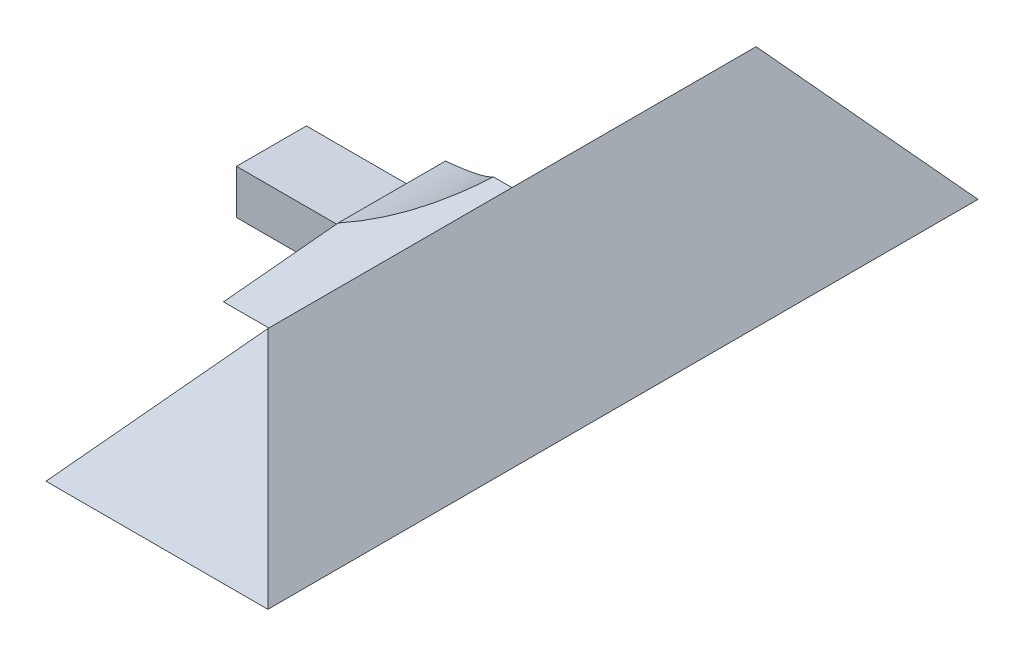
from build123d import *

# Parameters (mm, degrees)
BOSS_EXTRUDE1_START       = -105
BOSS_EXTRUDE1_DEPTH       = 160
BOSS_EXTRUDE1_2_DEPTH     = 40
BOSS_EXTRUDE1_START_2     = -20
BOSS_EXTRUDE1_3_OUTLINE_W = 47
BOSS_EXTRUDE1_3_OUTLINE_H = 147
BOSS_EXTRUDE1_3_DEPTH     = 20
BOSS_EXTRUDE1_START_3     = 42.132444372
BOSS_EXTRUDE1_4_OUTLINE_W = 53
BOSS_EXTRUDE1_4_OUTLINE_H = 116
BOSS_EXTRUDE1_4_DEPTH     = 19.867555628
BOSS_EXTRUDE1_START_4     = 80.434666527
BOSS_EXTRUDE1_5_OUTLINE_W = 52
BOSS_EXTRUDE1_5_OUTLINE_H = 117
BOSS_EXTRUDE1_5_DEPTH     = 20.565333473
SKETCH3_W                 = 27.900715286
SKETCH3_H                 = 15.750403791
BOSS_EXTRUDE2_DEPTH       = 10
SKETCH4_R                 = 75
CUT_EXTRUDE1_DEPTH        = 80


with BuildPart() as part:
    # Boss-Extrude1: read off the stored shape, not the designer's step
    # Boss-Extrude1 outline → Boss-Extrude1 (new body)
    with BuildSketch(Plane.XY.offset(BOSS_EXTRUDE1_START)):
        Polygon((65, 0), (40, 29.793839815), (15, 0), align=None)
    extrude(amount=BOSS_EXTRUDE1_DEPTH)

    # Boss-Extrude1 2 outline → Boss-Extrude1 2 (add)
    with BuildSketch(Plane.YZ):
        Polygon((0, -50), (29.793839815, -25), (0, 0), align=None)
    extrude(amount=BOSS_EXTRUDE1_2_DEPTH)

    # Boss-Extrude1 3 outline → Boss-Extrude1 3 (cut)
    with BuildSketch(Plane(origin=(0, 0, 0), x_dir=(0.6427876096865404, 0.7660444431189772, 0), z_dir=(0.7660444431189772, -0.6427876096865403, 0)).offset(BOSS_EXTRUDE1_START_2)):
        with Locations((22.5, -24.5)):
            Rectangle(BOSS_EXTRUDE1_3_OUTLINE_W, BOSS_EXTRUDE1_3_OUTLINE_H)
    extrude(amount=BOSS_EXTRUDE1_3_DEPTH, mode=Mode.SUBTRACT)

    # Boss-Extrude1 4 outline → Boss-Extrude1 4 (cut)
    with BuildSketch(Plane(origin=(0, 0, 0), x_dir=(1, 0, 0), z_dir=(0, 0.6427876096865403, 0.7660444431189772)).offset(BOSS_EXTRUDE1_START_3)):
        with Locations((40.5, 21)):
            Rectangle(BOSS_EXTRUDE1_4_OUTLINE_W, BOSS_EXTRUDE1_4_OUTLINE_H)
    extrude(amount=BOSS_EXTRUDE1_4_DEPTH, mode=Mode.SUBTRACT)

    # Boss-Extrude1 5 outline → Boss-Extrude1 5 (cut)
    with BuildSketch(Plane(origin=(0, 0, 0), x_dir=(1, 0, 0), z_dir=(0, 0.6427876096865403, -0.7660444431189772)).offset(BOSS_EXTRUDE1_START_4)):
        with Locations((40, 10.5)):
            Rectangle(BOSS_EXTRUDE1_5_OUTLINE_W, BOSS_EXTRUDE1_5_OUTLINE_H)
    extrude(amount=BOSS_EXTRUDE1_5_DEPTH, mode=Mode.SUBTRACT)

    # Sketch3 → Boss-Extrude2 (add)
    with BuildSketch(Plane.XZ):
        with Locations((-1.039193036, -25.78752019)):
            Rectangle(SKETCH3_W, SKETCH3_H)
    extrude(amount=-BOSS_EXTRUDE2_DEPTH)

    # Sketch4 → Cut-Extrude1 (cut, symmetric)
    with BuildSketch(Plane.XY):
        with Locations((-14.989550679, 85)):
            Circle(SKETCH4_R)
    extrude(amount=CUT_EXTRUDE1_DEPTH, both=True, mode=Mode.SUBTRACT)


solid = part.part
